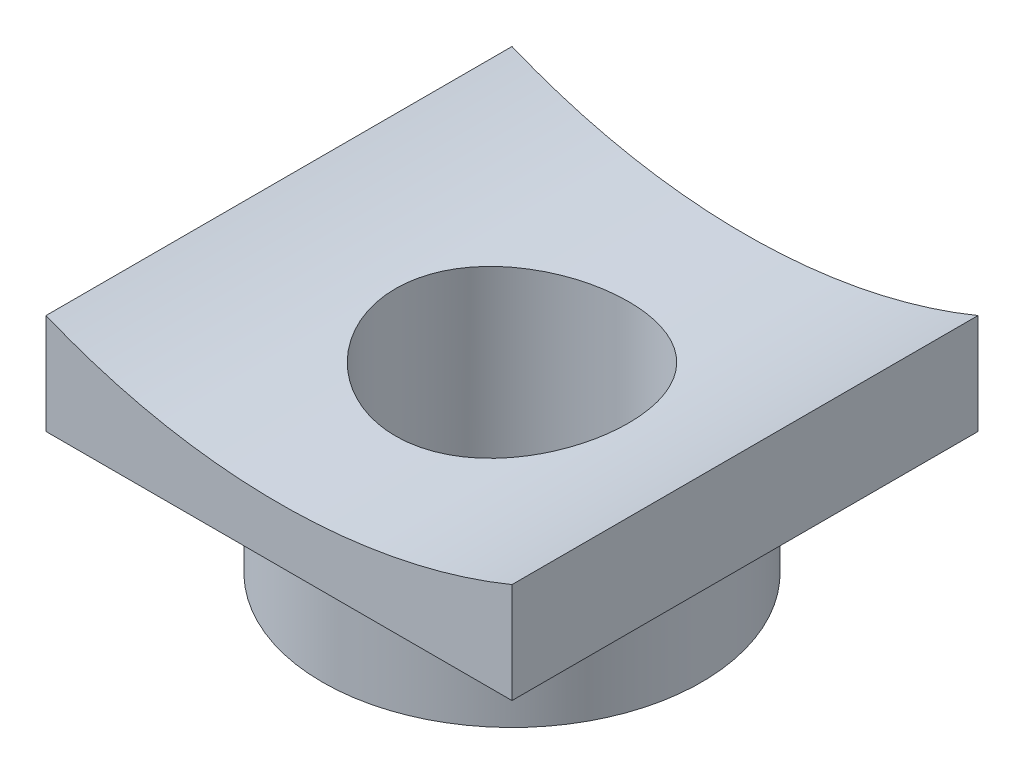
from build123d import *

# Parameters (mm, degrees)
RESSALTO_EXTRUS_O1_DEPTH     = 76.2
ESBO_O2_W                    = 31
ESBO_O2_H                    = 20
FURO_COM_FOLGA_DE_M361_D     = 38.1
FURO_COM_FOLGA_DE_M361_DEPTH = 36.425904813


with BuildPart() as part:
    # Esboço1 → Ressalto-extrusão1 (new body)
    with BuildSketch(Plane(origin=(0, 0, -38.1), x_dir=(-1, 0, 0), z_dir=(0, 0, -1))):
        with BuildLine():
            Line((-38.1, -3.574095187), (-38.1, -20))
            Line((-38.1, -20), (38.1, -20))
            Line((38.1, -20), (38.1, -3.574095187))
            ThreePointArc((38.1, -3.574095187), (0, -11.116591435), (-38.1, -3.574095187))
        make_face()
    extrude(amount=-RESSALTO_EXTRUS_O1_DEPTH)

    # Esboço2 → Revolução1 (revolve)
    with BuildSketch(Plane(origin=(0, 0, 0), x_dir=(-1, 0, 0), z_dir=(0, 0, -1))):
        with Locations((-15.5, -30)):
            Rectangle(ESBO_O2_W, ESBO_O2_H)
    revolve(axis=Axis((0, -40, 0), (0, 1, 0)))

    # Furo com folga de M361
    with Locations(Plane(origin=(0, -40, 0), x_dir=(-1, 0, 0), z_dir=(0, -1, 0))):
        with Locations((0, 0)):
            Hole(FURO_COM_FOLGA_DE_M361_D / 2, depth=FURO_COM_FOLGA_DE_M361_DEPTH)


solid = part.part
